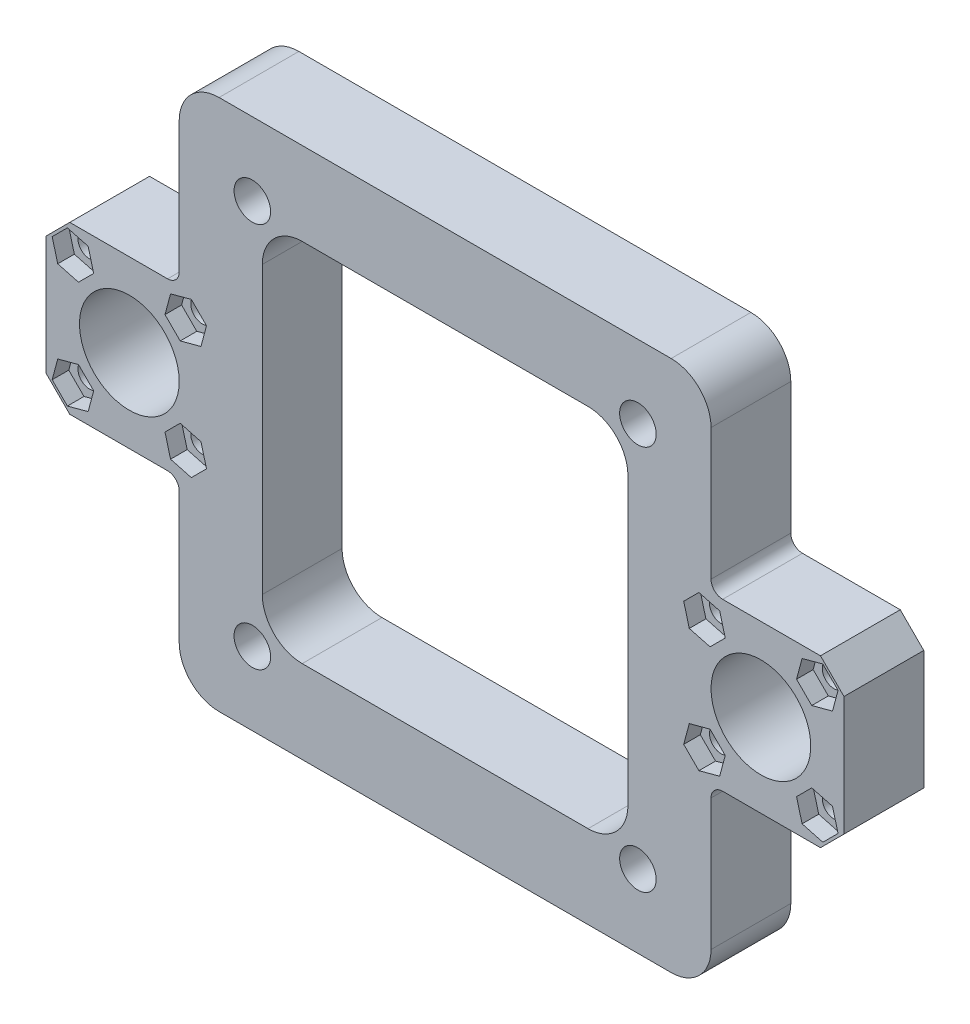
from build123d import *

# Parameters (mm, degrees)
SKETCH1_R               = 7.5
SKETCH1_R_2             = 1.75
SKETCH1_R_3             = 2.75
BOSS_EXTRUDE1_DEPTH     = 12
CUT_EXTRUDE1_DEPTH      = 74.10266753
CUT_EXTRUDE1_DEPTH_BACK = 74.10266753
CUT_EXTRUDE2_DEPTH      = 2.5


with BuildPart() as part:
    # Sketch1 → Boss-Extrude1 (new body)
    with BuildSketch(Plane.XY):
        with BuildLine():
            Line((-56.464466094, 12.5), (-41.75, 12.5))
            ThreePointArc((-41.75, 12.5), (-40.512563133, 13.012563133), (-40, 14.25))
            Line((-40, 14.25), (-40, 34))
            ThreePointArc((-40, 34), (-38.242640687, 38.242640687), (-34, 40))
            Line((-34, 40), (34, 40))
            ThreePointArc((34, 40), (38.242640687, 38.242640687), (40, 34))
            Line((40, 34), (40, 14.25))
            ThreePointArc((40, 14.25), (40.512563133, 13.012563133), (41.75, 12.5))
            Line((41.75, 12.5), (56.464466094, 12.5))
            Line((56.464466094, 12.5), (60, 8.964466094))
            Line((60, 8.964466094), (60, -8.964466094))
            Line((60, -8.964466094), (56.464466094, -12.5))
            Line((56.464466094, -12.5), (41.75, -12.5))
            ThreePointArc((41.75, -12.5), (40.512563133, -13.012563133), (40, -14.25))
            Line((40, -14.25), (40, -34))
            ThreePointArc((40, -34), (38.242640687, -38.242640687), (34, -40))
            Line((34, -40), (-34, -40))
            ThreePointArc((-34, -40), (-38.242640687, -38.242640687), (-40, -34))
            Line((-40, -34), (-40, -14.25))
            ThreePointArc((-40, -14.25), (-40.512563133, -13.012563133), (-41.75, -12.5))
            Line((-41.75, -12.5), (-56.464466094, -12.5))
            Line((-56.464466094, -12.5), (-60, -8.964466094))
            Line((-60, -8.964466094), (-60, 8.964466094))
            Line((-60, 8.964466094), (-56.464466094, 12.5))
        make_face()
        with Locations((-47.5, 0)):
            Circle(SKETCH1_R, mode=Mode.SUBTRACT)
        with Locations((47.5, 0)):
            Circle(SKETCH1_R, mode=Mode.SUBTRACT)
        with Locations((-55.985281374, 8.485281374)):
            Circle(SKETCH1_R_2, mode=Mode.SUBTRACT)
        with Locations((-39.014718626, -8.485281374)):
            Circle(SKETCH1_R_2, mode=Mode.SUBTRACT)
        with Locations((-39.014718626, 8.485281374)):
            Circle(SKETCH1_R_2, mode=Mode.SUBTRACT)
        with Locations((-55.985281374, -8.485281374)):
            Circle(SKETCH1_R_2, mode=Mode.SUBTRACT)
        with Locations((39.014718626, -8.485281374)):
            Circle(SKETCH1_R_2, mode=Mode.SUBTRACT)
        with Locations((55.985281374, -8.485281374)):
            Circle(SKETCH1_R_2, mode=Mode.SUBTRACT)
        with Locations((55.985281374, 8.485281374)):
            Circle(SKETCH1_R_2, mode=Mode.SUBTRACT)
        with Locations((39.014718626, 8.485281374)):
            Circle(SKETCH1_R_2, mode=Mode.SUBTRACT)
        with Locations((-29, 29)):
            Circle(SKETCH1_R_3, mode=Mode.SUBTRACT)
        with Locations((29, 29)):
            Circle(SKETCH1_R_3, mode=Mode.SUBTRACT)
        with Locations((29, -29)):
            Circle(SKETCH1_R_3, mode=Mode.SUBTRACT)
        with Locations((-29, -29)):
            Circle(SKETCH1_R_3, mode=Mode.SUBTRACT)
    extrude(amount=BOSS_EXTRUDE1_DEPTH)

    # Sketch2 → Cut-Extrude1 (cut, two sides: drawn at the far end of the back side and taken through both)
    with BuildSketch(Plane.XY.offset(12).offset(-CUT_EXTRUDE1_DEPTH_BACK)):
        with BuildLine():
            Line((-21.5, 27.5), (21.5, 27.5))
            ThreePointArc((21.5, 27.5), (25.742640687, 25.742640687), (27.5, 21.5))
            Line((27.5, 21.5), (27.5, -21.5))
            ThreePointArc((27.5, -21.5), (25.742640687, -25.742640687), (21.5, -27.5))
            Line((21.5, -27.5), (-21.5, -27.5))
            ThreePointArc((-21.5, -27.5), (-25.742640687, -25.742640687), (-27.5, -21.5))
            Line((-27.5, -21.5), (-27.5, 21.5))
            ThreePointArc((-27.5, 21.5), (-25.742640687, 25.742640687), (-21.5, 27.5))
        make_face()
    extrude(amount=CUT_EXTRUDE1_DEPTH + CUT_EXTRUDE1_DEPTH_BACK, mode=Mode.SUBTRACT)

    # Sketch3 → Cut-Extrude2 (cut)
    with BuildSketch(Plane.XY.offset(12)):
        Polygon((-55.1484776, 5.362287174), (-52.862287174, 7.6484776), (-53.699090948, 10.771471801), (-56.822085148, 11.608275575), (-59.108275575, 9.322085148), (-58.271471801, 6.199090948), align=None)
        Polygon((-42.137712826, 7.6484776), (-39.8515224, 5.362287174), (-36.728528199, 6.199090948), (-35.891724425, 9.322085148), (-38.177914852, 11.608275575), (-41.300909052, 10.771471801), align=None)
        Polygon((-39.8515224, -5.362287174), (-42.137712826, -7.6484776), (-41.300909052, -10.771471801), (-38.177914852, -11.608275575), (-35.891724425, -9.322085148), (-36.728528199, -6.199090948), align=None)
        Polygon((-52.862287174, -7.6484776), (-55.1484776, -5.362287174), (-58.271471801, -6.199090948), (-59.108275575, -9.322085148), (-56.822085148, -11.608275575), (-53.699090948, -10.771471801), align=None)
    cut_extrude2 = extrude(amount=-CUT_EXTRUDE2_DEPTH, mode=Mode.SUBTRACT)

    # Mirror1: Cut-Extrude2 across plane
    add(cut_extrude2.mirror(Plane(origin=(0, 0, 0), x_dir=(0, 0, 1), z_dir=(1, 0, 0))), mode=Mode.SUBTRACT)


solid = part.part
